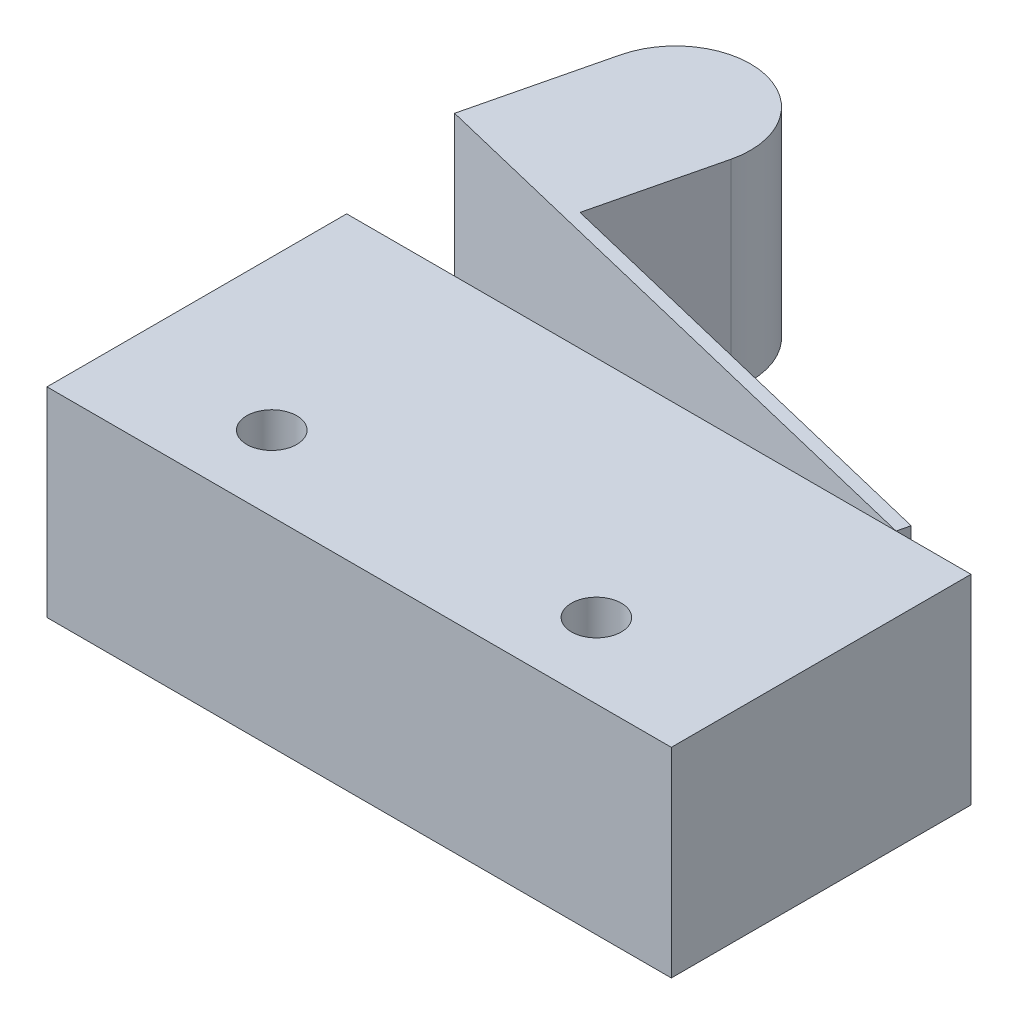
from build123d import *

# Parameters (mm, degrees)
SKETCH1_W           = 19.84375
SKETCH1_H           = 9.525
BOSS_EXTRUDE1_DEPTH = 6.35
SKETCH2_R           = 0.79375
CUT_EXTRUDE1_DEPTH  = 13.706199659
BOSS_EXTRUDE2_DEPTH = 6.35
FILLET1_R           = 2.38125


with BuildPart() as part:
    # Sketch1 → Boss-Extrude1 (new body)
    with BuildSketch(Plane(origin=(0, 0, 0), x_dir=(1, 0, 0), z_dir=(0, 1, 0))):
        Rectangle(SKETCH1_W, SKETCH1_H)
    extrude(amount=BOSS_EXTRUDE1_DEPTH)

    # Sketch2 → Cut-Extrude1 (cut, through all)
    with BuildSketch(Plane(origin=(0, 6.35, 0), x_dir=(1, 0, 0), z_dir=(0, 1, 0))):
        with Locations(Location((-5.159375, -2.38125, 0), (0, 0, 270))):
            Circle(SKETCH2_R)
        with Locations(Location((5.159375, -2.38125, 0), (0, 0, 270))):
            Circle(SKETCH2_R)
    extrude(amount=-CUT_EXTRUDE1_DEPTH, mode=Mode.SUBTRACT)


with BuildPart() as body_2:
    # Sketch3 → Boss-Extrude2 (new body)
    with BuildSketch(Plane(origin=(0, 0, 0), x_dir=(1, 0, 0), z_dir=(0, 1, 0))):
        Polygon((7.540625, 4.7625), (-10.974426706, 9.245284885), (-10.881035354, 9.631015129), (-9.386773726, 15.802699031), (-4.758010799, 14.68200281), (-6.252272428, 8.510318908), (7.634016352, 5.148230244), align=None)
    extrude(amount=BOSS_EXTRUDE2_DEPTH)

    # Fillet1
    fillet1_edges = [body_2.edges().sort_by_distance(p)[0] for p in [
        (-4.758010799, 3.175, -14.68200281),
        (-9.386773726, 3.175, -15.802699031),
    ]]
    fillet(fillet1_edges, radius=FILLET1_R - 0.0001)  # a hair under: the kernel refuses the full size


solid = Compound([part.part, body_2.part])
